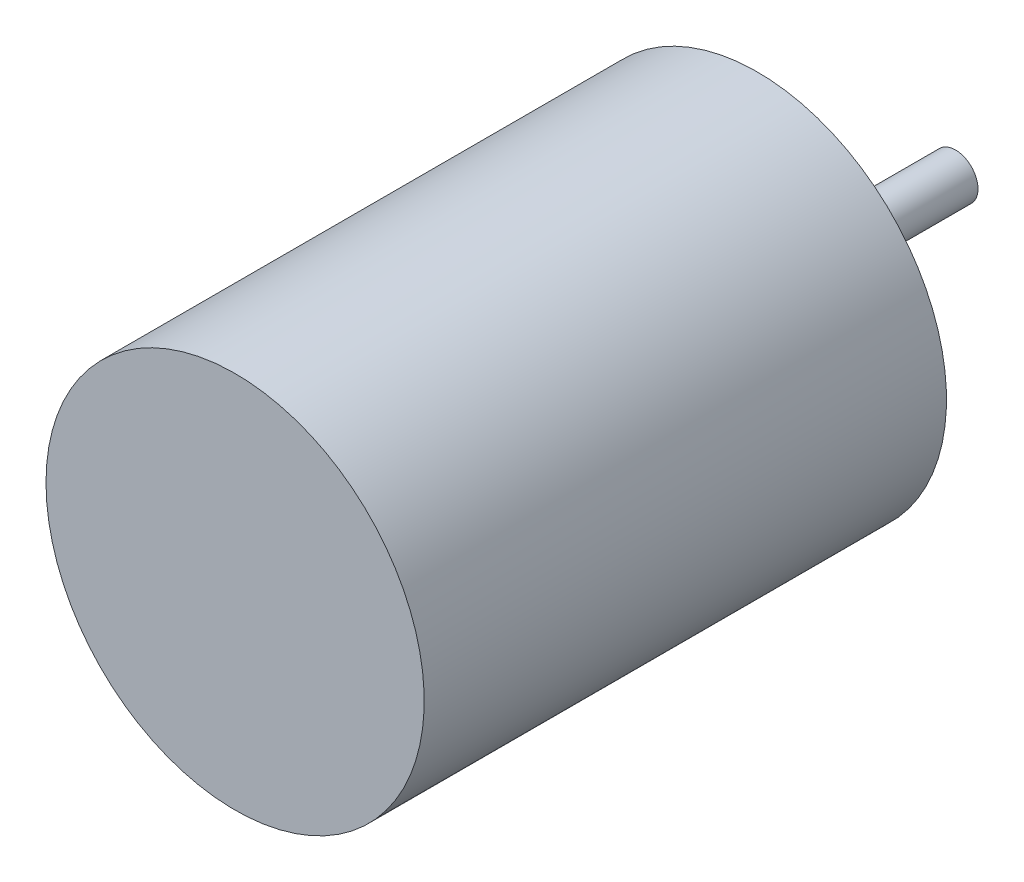
from build123d import *

# Parameters (mm, degrees)
SKETCH1_R         = 21
EXTRUDE_296_DEPTH = 58
SKETCH2_R         = 2.5
EXTRUDE_387_DEPTH = 22


with BuildPart() as part:
    # Sketch1 → Extrude 296 (new body)
    with BuildSketch(Plane.XY):
        with Locations((75.771006381, -68.582665129)):
            Circle(SKETCH1_R)
    extrude(amount=EXTRUDE_296_DEPTH)

    # Sketch2 → Extrude 387 (add)
    with BuildSketch(Plane(origin=(0, 0, 0), x_dir=(-1, 0, 0), z_dir=(0, 0, -1))):
        with Locations((-75.771006381, -68.582665129)):
            Circle(SKETCH2_R)
    extrude(amount=EXTRUDE_387_DEPTH)


solid = part.part
